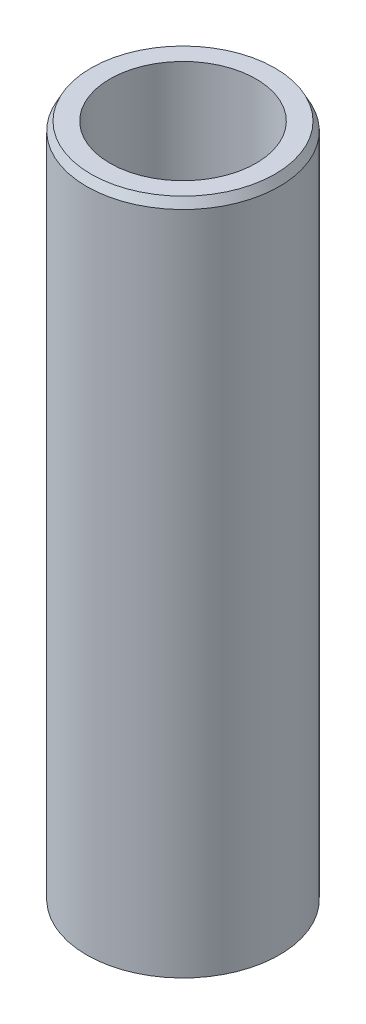
from build123d import *
from OCP.BRepFilletAPI import BRepFilletAPI_MakeChamfer

# Parameters (mm, degrees)
SKETCH1_R           = 47.5
BOSS_EXTRUDE1_DEPTH = 334.30078386
SKETCH2_R           = 36.010057732
CUT_EXTRUDE1_DEPTH  = 341.983158073
CHAMFER1_SIZE       = 4.162700259
CHAMFER1_SIZE2      = 2.186075959


with BuildPart() as part:
    # Sketch1 → Boss-Extrude1 (new body)
    with BuildSketch(Plane(origin=(0, 0, 0), x_dir=(1, 0, 0), z_dir=(0, 1, 0))):
        Circle(SKETCH1_R)
    extrude(amount=BOSS_EXTRUDE1_DEPTH)

    # Sketch2 → Cut-Extrude1 (cut, through all)
    with BuildSketch(Plane(origin=(0, 0, 0), x_dir=(1, 0, 0), z_dir=(0, 1, 0))):
        Circle(SKETCH2_R)
    extrude(amount=CUT_EXTRUDE1_DEPTH, mode=Mode.SUBTRACT)

    # Chamfer1: one chamfer whose edges measure the first distance from different faces: ONE call of the kernel's chamfer builder (chamfer() names one face for all edges)
    chamfer1_edges_1 = [part.edges().sort_by_distance(p)[0] for p in [
        (-47.5, 334.30078386, 0),
    ]]
    chamfer1_side_1 = [part.faces().sort_by_distance(p)[0] for p in [
        (-47.5, 167.15039193, 0),
    ]]
    chamfer1_edges_2 = [part.edges().sort_by_distance(p)[0] for p in [
        (-47.5, 0, 0),
    ]]
    chamfer1_side_2 = [part.faces().sort_by_distance(p)[0] for p in [
        (-46.156497116, 0, 0),
    ]]
    chamfer1 = BRepFilletAPI_MakeChamfer(part.part.solid().wrapped)
    for e in chamfer1_edges_1:
        chamfer1.Add(CHAMFER1_SIZE, CHAMFER1_SIZE2, e.wrapped, chamfer1_side_1[0].wrapped)  # the first distance lies on this face
    for e in chamfer1_edges_2:
        chamfer1.Add(CHAMFER1_SIZE, CHAMFER1_SIZE2, e.wrapped, chamfer1_side_2[0].wrapped)  # the first distance lies on this face
    add(Compound.cast(chamfer1.Shape()), mode=Mode.REPLACE)


solid = part.part
